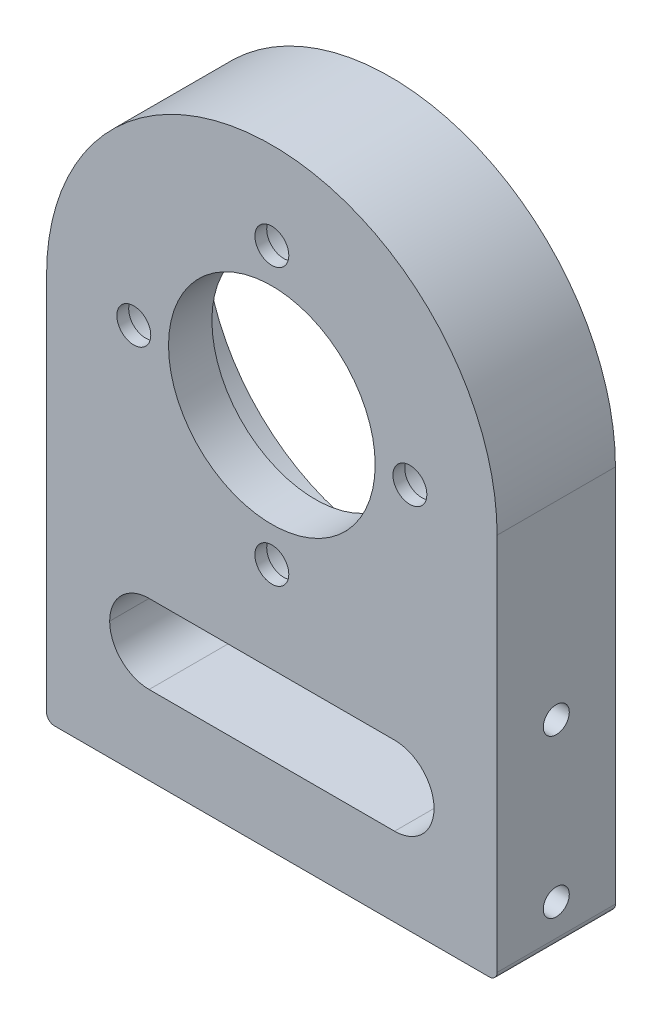
from build123d import *

# Parameters (mm, degrees)
SKETCH_1_R           = 13.1
SKETCH_1_R_2         = 2.15
EXTRUDE_1_DEPTH      = 15
SKETCH_2_R           = 1.65
CUT_EXTRUDE_2_DEPTH  = 10
FILLET_3_R           = 1
SKETCH_7_R           = 23.5
CUT_EXTRUDE_7_DEPTH  = 9
SKETCH_9_R           = 22.5
CUT_EXTRUDE_9_DEPTH  = 0.5
SKETCH_10_R          = 4
CUT_EXTRUDE_10_DEPTH = 4
CUT_EXTRUDE_11_DEPTH = 80.771072474
SKETCH_12_W          = 41.12
SKETCH_12_H          = 10
CUT_EXTRUDE_12_DEPTH = 74.965581185
FILLET_4_R           = 5


with BuildPart() as part:
    # ｽｹｯﾁ1 → ﾎﾞｽ - 押し出し1 (new body)
    with BuildSketch(Plane.XY):
        with BuildLine():
            Line((-28.56, -11), (28.56, -11))
            Line((28.56, -11), (28.56, 21.386752274))
            ThreePointArc((28.56, 21.386752274), (0, 71.040484258), (-28.56, 21.386752274))
            Line((-28.56, 21.386752274), (-28.56, -11))
        make_face()
        with Locations((0, 38)):
            Circle(SKETCH_1_R, mode=Mode.SUBTRACT)
        with Locations((0, 55.5)):
            Circle(SKETCH_1_R_2, mode=Mode.SUBTRACT)
        with Locations((17.5, 38)):
            Circle(SKETCH_1_R_2, mode=Mode.SUBTRACT)
        with Locations((0, 20.5)):
            Circle(SKETCH_1_R_2, mode=Mode.SUBTRACT)
        with Locations((-17.5, 38)):
            Circle(SKETCH_1_R_2, mode=Mode.SUBTRACT)
    extrude(amount=EXTRUDE_1_DEPTH)

    # ｽｹｯﾁ2 → ｶｯﾄ - 押し出し2 (cut)
    with BuildSketch(Plane(origin=(28.56, 0, 0), x_dir=(0, 0, -1), z_dir=(1, 0, 0))):
        with Locations((-7.5, -6)):
            Circle(SKETCH_2_R)
        with Locations((-7.5, 14)):
            Circle(SKETCH_2_R)
    cut_extrude_2 = extrude(amount=-CUT_EXTRUDE_2_DEPTH, mode=Mode.SUBTRACT)

    # ﾐﾗｰ2: ｶｯﾄ - 押し出し2 across plane
    add(cut_extrude_2.mirror(Plane.ZY), mode=Mode.SUBTRACT)

    # ﾌｨﾚｯﾄ3
    fillet_3_edges = [part.edges().sort_by_distance(p)[0] for p in [
        (28.56, -11, 7.5),
        (-28.56, -11, 7.5),
    ]]
    fillet(fillet_3_edges, radius=FILLET_3_R)

    # ｽｹｯﾁ7 → ｶｯﾄ - 押し出し7 (cut)
    with BuildSketch(Plane(origin=(0, 0, 0), x_dir=(-1, 0, 0), z_dir=(0, 0, -1))):
        with Locations((0, 38)):
            Circle(SKETCH_7_R)
    extrude(amount=-CUT_EXTRUDE_7_DEPTH, mode=Mode.SUBTRACT)

    # ｽｹｯﾁ9 → ｶｯﾄ - 押し出し9 (cut)
    with BuildSketch(Plane(origin=(0, 0, 9), x_dir=(-1, 0, 0), z_dir=(0, 0, -1))):
        with Locations((0, 38)):
            Circle(SKETCH_9_R)
    extrude(amount=-CUT_EXTRUDE_9_DEPTH, mode=Mode.SUBTRACT)

    # ｽｹｯﾁ10 → ｶｯﾄ - 押し出し10 (cut)
    with BuildSketch(Plane(origin=(0, 0, 9.5), x_dir=(-1, 0, 0), z_dir=(0, 0, -1))):
        with Locations((0, 55.5)):
            Circle(SKETCH_10_R)
        with Locations((17.5, 38)):
            Circle(SKETCH_10_R)
        with Locations((-17.5, 38)):
            Circle(SKETCH_10_R)
        with Locations((0, 20.5)):
            Circle(SKETCH_10_R)
    extrude(amount=-CUT_EXTRUDE_10_DEPTH, mode=Mode.SUBTRACT)

    # ｽｹｯﾁ11 → ｶｯﾄ - 押し出し11 (cut, through all)
    with BuildSketch(Plane(origin=(0, 0, 0), x_dir=(-1, 0, 0), z_dir=(0, 0, -1))):
        with BuildLine():
            Line((-28.56, 21.386752274), (-28.56, 38))
            ThreePointArc((-28.56, 38), (0, 66.56), (28.56, 38))
            Line((28.56, 38), (28.56, 21.386752274))
            ThreePointArc((28.56, 21.386752274), (31.900703992, 29.39658877), (33.040484258, 38))
            ThreePointArc((33.040484258, 38), (-8.60341123, 69.900703992), (-28.56, 21.386752274))
        make_face()
    extrude(amount=-CUT_EXTRUDE_11_DEPTH, mode=Mode.SUBTRACT)

    # ｽｹｯﾁ12 → ｶｯﾄ - 押し出し12 (cut, through all)
    with BuildSketch(Plane(origin=(0, 0, 0), x_dir=(-1, 0, 0), z_dir=(0, 0, -1))):
        with Locations((0, 4)):
            Rectangle(SKETCH_12_W, SKETCH_12_H)
    extrude(amount=-CUT_EXTRUDE_12_DEPTH, mode=Mode.SUBTRACT)

    # ﾌｨﾚｯﾄ4
    fillet_4_edges = [part.edges().sort_by_distance(p)[0] for p in [
        (-20.56, 9, 7.5),
        (-20.56, -1, 7.5),
        (20.56, 9, 7.5),
        (20.56, -1, 7.5),
    ]]
    fillet(fillet_4_edges, radius=FILLET_4_R - 0.0001)  # a hair under: the kernel refuses the full size


solid = part.part
